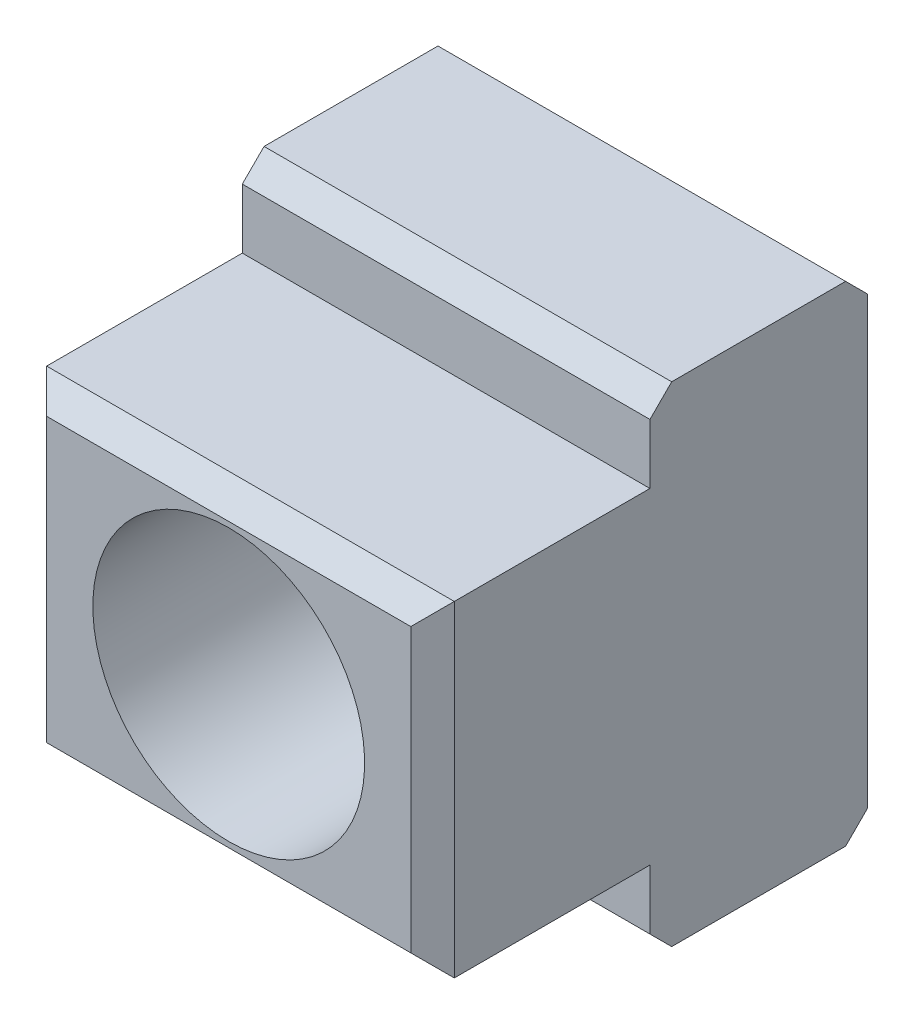
from build123d import *

# Parameters (mm, degrees)
SALIENTE_EXTRUIR1_START     = -14.8
SALIENTE_EXTRUIR1_OUTLINE_W = 17.2
SALIENTE_EXTRUIR1_OUTLINE_H = 14
SALIENTE_EXTRUIR1_DEPTH     = 15.6
CROQUIS2_W                  = 14
CROQUIS2_H                  = 14.8
SALIENTE_EXTRUIR2_DEPTH     = 0.8
CROQUIS3_W                  = 18
CROQUIS3_H                  = 7
SALIENTE_EXTRUIR3_DEPTH     = 3.2
CROQUIS4_W                  = 8
CROQUIS4_H                  = 3
CORTAR_EXTRUIR1_DEPTH       = 25.515301344
TALADRO1_D                  = 10
CHAFL_N1_SIZE               = 0.7
CROQUIS7_W                  = 7
CROQUIS7_H                  = 3.2
CORTAR_EXTRUIR2_DEPTH       = 23.6
CROQUIS8_W                  = 8
CROQUIS8_H                  = 0.599553283
SALIENTE_EXTRUIR4_DEPTH     = 18
CROQUIS9_W                  = 8
CROQUIS9_H                  = 3
CORTAR_EXTRUIR3_DEPTH       = 23.3
CROQUIS10_W                 = 8
CROQUIS10_H                 = 18
SALIENTE_EXTRUIR5_DEPTH     = 18
CROQUIS11_OUTSIDE_W         = 26.014
CROQUIS11_OUTSIDE_H         = 26.014
CROQUIS11_OUTSIDE_W_2       = 15
CROQUIS11_OUTSIDE_H_2       = 18
CORTAR_EXTRUIR4_DEPTH       = 30.1
CHAFL_N3_SIZE               = 0.8
CROQUIS12_R                 = 5
CORTAR_EXTRUIR5_DEPTH       = 30.1


with BuildPart() as part:
    # Saliente-Extruir1: read off the stored shape, not the designer's step
    # Saliente-Extruir1 outline → Saliente-Extruir1 (new body)
    with BuildSketch(Plane.XZ.offset(5.8).offset(SALIENTE_EXTRUIR1_START)):
        with Locations((0.4, -7)):
            Rectangle(SALIENTE_EXTRUIR1_OUTLINE_W, SALIENTE_EXTRUIR1_OUTLINE_H)
    extrude(amount=SALIENTE_EXTRUIR1_DEPTH)

    # Saliente-Extruir1 2 outline → Saliente-Extruir1 2 (revolve, cut)
    with BuildSketch(Plane(origin=(-7.4, 0, -3.5), x_dir=(1, 0, 0), z_dir=(0, 0, 1))):
        with BuildLine():
            Line((19.473315075, -5.8), (0.8, -5.799999999))
            ThreePointArc((0.8, -5.799999999), (0.565685425, -6.365685425), (0, -6.6))
            Line((0, -6.6), (19.473315075, -6.6))
            Line((19.473315075, -6.6), (19.473315075, -5.8))
        make_face()
    revolve(axis=Axis((-7.4, 0, -3.5), (0, 1, 0)), mode=Mode.SUBTRACT)

    # Croquis2 → Saliente-Extruir2 (add)
    with BuildSketch(Plane.ZY.offset(8.2)):
        with Locations((-7, 1.6)):
            Rectangle(CROQUIS2_W, CROQUIS2_H)
    extrude(amount=SALIENTE_EXTRUIR2_DEPTH)

    # Croquis3 → Saliente-Extruir3 (add)
    with BuildSketch(Plane.XZ.offset(5.8)):
        with Locations((0, -10.5)):
            Rectangle(CROQUIS3_W, CROQUIS3_H)
    extrude(amount=SALIENTE_EXTRUIR3_DEPTH)

    # Croquis4 → Cortar-Extruir1 (cut, through all)
    with BuildSketch(Plane.ZY.offset(9)):
        with Locations((-4, 7.5)):
            Rectangle(CROQUIS4_W, CROQUIS4_H)
    extrude(amount=-CORTAR_EXTRUIR1_DEPTH, mode=Mode.SUBTRACT)

    # Taladro1 (through all)
    with Locations(Plane(origin=(0, 0, -14), x_dir=(-1, 0, 0), z_dir=(0, 0, -1))):
        with Locations((0, 0)):
            Hole(TALADRO1_D / 2)

    # Chaflán1
    chafl_n1_edges = [part.edges().sort_by_distance(p)[0] for p in [
        (0, 9, -14),
        (0, -9, -14),
    ]]
    chamfer(chafl_n1_edges, length=CHAFL_N1_SIZE)

    # Croquis7 → Cortar-Extruir2 (cut)
    with BuildSketch(Plane(origin=(9, 0, 0), x_dir=(0, 0, -1), z_dir=(1, 0, 0))):
        with Locations((3.5, -7.4)):
            Rectangle(CROQUIS7_W, CROQUIS7_H)
    extrude(amount=-CORTAR_EXTRUIR2_DEPTH, mode=Mode.SUBTRACT)

    # Croquis8 → Saliente-Extruir4 (add)
    with BuildSketch(Plane.ZY.offset(9)):
        with Locations((-4, -5.700223359)):
            Rectangle(CROQUIS8_W, CROQUIS8_H)
    extrude(amount=-SALIENTE_EXTRUIR4_DEPTH)

    # Croquis9 → Cortar-Extruir3 (cut)
    with BuildSketch(Plane.ZY.offset(9)):
        with Locations((-4, -7.5)):
            Rectangle(CROQUIS9_W, CROQUIS9_H)
    extrude(amount=-CORTAR_EXTRUIR3_DEPTH, mode=Mode.SUBTRACT)

    # Croquis10 → Saliente-Extruir5 (add)
    with BuildSketch(Plane.ZY.offset(9)):
        with Locations((-12, 0)):
            Rectangle(CROQUIS10_W, CROQUIS10_H)
    extrude(amount=-SALIENTE_EXTRUIR5_DEPTH)

    # Croquis11 outside → Cortar-Extruir4 (cut)
    with BuildSketch(Plane.XY):
        Rectangle(CROQUIS11_OUTSIDE_W, CROQUIS11_OUTSIDE_H)
        Rectangle(CROQUIS11_OUTSIDE_W_2, CROQUIS11_OUTSIDE_H_2, mode=Mode.SUBTRACT)
    extrude(amount=-CORTAR_EXTRUIR4_DEPTH, mode=Mode.SUBTRACT)

    # Chaflán3
    chafl_n3_edges = [part.edges().sort_by_distance(p)[0] for p in [
        (0, 9, -16),
        (0, -9, -16),
        (0, -9, -8),
        (0, -6, 0),
        (0, 9, -8),
        (0, 6, 0),
        (-7.5, 0, 0),
        (7.5, 0, 0),
    ]]
    chamfer(chafl_n3_edges, length=CHAFL_N3_SIZE)

    # Croquis12 → Cortar-Extruir5 (cut)
    with BuildSketch(Plane.XY.offset(-8)):
        with Locations(Location((0, 0, 0), (0, 0, 90))):
            Circle(CROQUIS12_R)
    extrude(amount=-CORTAR_EXTRUIR5_DEPTH, mode=Mode.SUBTRACT)


solid = part.part
